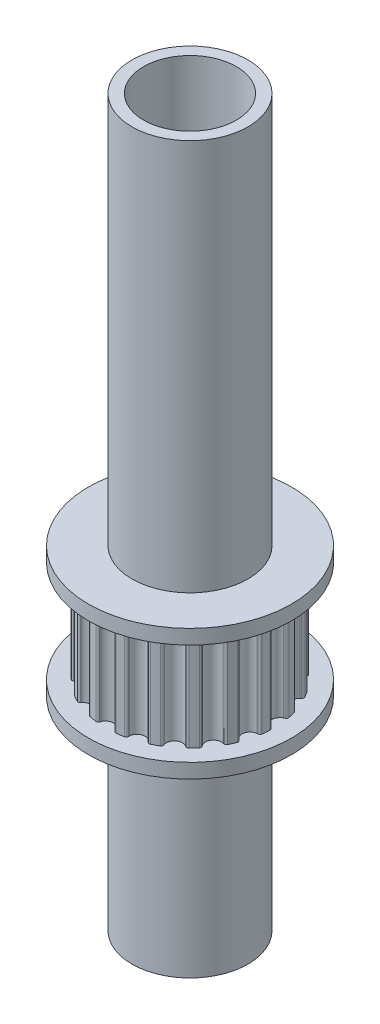
from build123d import *

# Parameters (mm, degrees)
SKETCH1_R           = 4
SKETCH1_R_2         = 3.2
BOSS_EXTRUDE1_DEPTH = 50
SKETCH2_R           = 6
SKETCH2_R_2         = 4
BOSS_EXTRUDE2_DEPTH = 7
SKETCH3_R           = 7
SKETCH3_R_2         = 4
BOSS_EXTRUDE3_DEPTH = 1
CUT_EXTRUDE1_DEPTH  = 7
CIRPATTERN1_COUNT   = 19
SKETCH4_R           = 7
SKETCH4_R_2         = 4
BOSS_EXTRUDE4_DEPTH = 1


with BuildPart() as part:
    # Sketch1 → Boss-Extrude1 (new body)
    with BuildSketch(Plane(origin=(0, 0, 0), x_dir=(1, 0, 0), z_dir=(0, 1, 0))):
        Circle(SKETCH1_R)
        Circle(SKETCH1_R_2, mode=Mode.SUBTRACT)
    extrude(amount=BOSS_EXTRUDE1_DEPTH)

    # Sketch2 → Boss-Extrude2 (add)
    with BuildSketch(Plane(origin=(0, 15, 0), x_dir=(1, 0, 0), z_dir=(0, 1, 0))):
        Circle(SKETCH2_R)
        Circle(SKETCH2_R_2, mode=Mode.SUBTRACT)
    extrude(amount=BOSS_EXTRUDE2_DEPTH)

    # Sketch6 → Cut-Extrude1 (cut)
    with BuildSketch(Plane(origin=(0, 15, 0), x_dir=(1, 0, 0), z_dir=(0, 1, 0))):
        with BuildLine():
            Line((0, 6.615527095), (0, 5.795))
            ThreePointArc((0, 5.795), (0.149150627, 5.793080277), (0.298202436, 5.787322378))
            ThreePointArc((0.298202436, 5.787322378), (0.391677024, 5.748245546), (0.438987206, 5.658656239))
            ThreePointArc((0.438987206, 5.658656239), (0.444862649, 5.622209456), (0.452079377, 5.586004378))
            ThreePointArc((0.452079377, 5.586004378), (0.898978771, 5.157769008), (1.464404105, 5.409560175))
            ThreePointArc((1.464404105, 5.409560175), (1.483443985, 5.44118883), (1.501303443, 5.473498714))
            ThreePointArc((1.501303443, 5.473498714), (1.576133246, 5.541799504), (1.677316186, 5.546948297))
            ThreePointArc((1.677316186, 5.546948297), (1.819526857, 5.501940296), (1.960532009, 5.453287013))
            Line((1.960532009, 5.453287013), (2.23812815, 6.225430197))
            ThreePointArc((2.23812815, 6.225430197), (1.13593499, 6.517273237), (0, 6.615527095))
        make_face()
    cut_extrude1 = extrude(amount=CUT_EXTRUDE1_DEPTH, mode=Mode.SUBTRACT)

    # CirPattern1: Cut-Extrude1 ×19 about axis
    cirpattern1_axis = Axis((0, 50, 0), (0, -1, 0))
    for i in range(1, CIRPATTERN1_COUNT):
        add(cut_extrude1.rotate(cirpattern1_axis, i * 360 / CIRPATTERN1_COUNT), mode=Mode.SUBTRACT)

    # Sketch4 → Boss-Extrude4 (add)
    with BuildSketch(Plane(origin=(0, 22, 0), x_dir=(1, 0, 0), z_dir=(0, 1, 0))):
        Circle(SKETCH4_R)
        Circle(SKETCH4_R_2, mode=Mode.SUBTRACT)
    extrude(amount=BOSS_EXTRUDE4_DEPTH)


with BuildPart() as body_2:
    # Sketch3 → Boss-Extrude3 (new body)
    with BuildSketch(Plane.XZ.offset(-15)):
        Circle(SKETCH3_R)
        Circle(SKETCH3_R_2, mode=Mode.SUBTRACT)
    extrude(amount=BOSS_EXTRUDE3_DEPTH)


solid = Compound([part.part, body_2.part])
